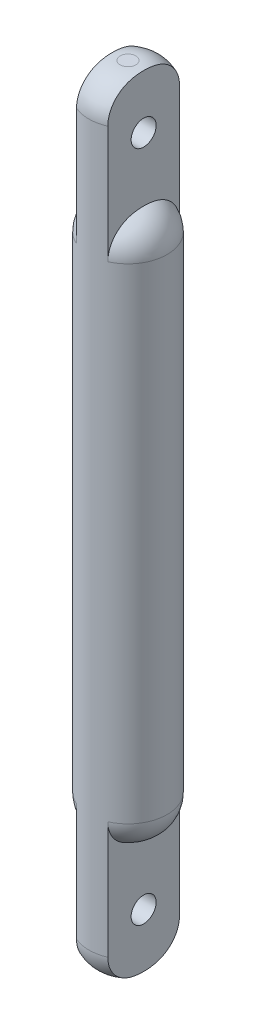
from build123d import *

# Parameters (mm, degrees)
SKETCH10_R              = 5
BOSS_EXTRUDE1_DEPTH     = 100
SKETCH11_W              = 10
SKETCH11_H              = 15
CUT_EXTRUDE1_DEPTH      = 100
SKETCH12_R              = 1.6
CUT_EXTRUDE2_DEPTH      = 101.369318021
MIRROR8_COPY_1_SKETCH_W = 10
MIRROR8_COPY_1_SKETCH_H = 15
MIRROR8_COPY_1_DEPTH    = 100
MIRROR8_COPY_2_SKETCH_W = 10
MIRROR8_COPY_2_SKETCH_H = 15
MIRROR8_COPY_2_DEPTH    = 100
FILLET1_R               = 4
FILLET2_R               = 4


with BuildPart() as part:
    # Sketch10 → Boss-Extrude1 (new body)
    with BuildSketch(Plane(origin=(0, 0, 0), x_dir=(1, 0, 0), z_dir=(0, 1, 0))):
        with Locations(Location((0, 0, 0), (0, 0, 270))):
            Circle(SKETCH10_R)
    extrude(amount=BOSS_EXTRUDE1_DEPTH)

    # Sketch11 → Cut-Extrude1 (cut)
    with BuildSketch(Plane(origin=(2, 0, 0), x_dir=(0, 0, -1), z_dir=(1, 0, 0))):
        with Locations((0, 7.5)):
            Rectangle(SKETCH11_W, SKETCH11_H)
    cut_extrude1 = extrude(amount=CUT_EXTRUDE1_DEPTH, mode=Mode.SUBTRACT)

    # Mirror1: Cut-Extrude1 across plane
    add(cut_extrude1.mirror(Plane(origin=(0, 0, 0), x_dir=(0, 0, 1), z_dir=(1, 0, 0))), mode=Mode.SUBTRACT)

    # Sketch12 → Cut-Extrude2 (cut, through all)
    with BuildSketch(Plane.ZY.offset(2)):
        with Locations((0, 7)):
            Circle(SKETCH12_R)
    cut_extrude2 = extrude(amount=-CUT_EXTRUDE2_DEPTH, mode=Mode.SUBTRACT)

    # Mirror7: Cut-Extrude1 across plane
    add(cut_extrude1.mirror(Plane(origin=(0, 50, 0), x_dir=(0, 0, 1), z_dir=(0, -1, 0))), mode=Mode.SUBTRACT)

    # Mirror8 copy 1 sketch → Mirror8 copy 1 (cut)
    with BuildSketch(Plane(origin=(-2, 100, 0), x_dir=(0, 0, -1), z_dir=(-1, 0, 0))):
        with Locations((0, 7.5)):
            Rectangle(MIRROR8_COPY_1_SKETCH_W, MIRROR8_COPY_1_SKETCH_H)
    extrude(amount=MIRROR8_COPY_1_DEPTH, mode=Mode.SUBTRACT)

    # Mirror8 copy 2 sketch → Mirror8 copy 2 (cut)
    with BuildSketch(Plane(origin=(2, 100, 0), x_dir=(0, 0, -1), z_dir=(1, 0, 0))):
        with Locations((0, -7.5)):
            Rectangle(MIRROR8_COPY_2_SKETCH_W, MIRROR8_COPY_2_SKETCH_H)
    extrude(amount=MIRROR8_COPY_2_DEPTH, mode=Mode.SUBTRACT)

    # Mirror9: Cut-Extrude2 across plane
    add(cut_extrude2.mirror(Plane(origin=(0, 50, 0), x_dir=(0, 0, 1), z_dir=(0, -1, 0))), mode=Mode.SUBTRACT)

    # Fillet1
    # the kernel refuses this fillet: 4 mm, written as the material it takes off along each edge
    with BuildSketch(Plane(origin=(0, 15, 0), x_dir=(0.9999950652018581, 0, 0.003141587485879613), z_dir=(0.003141587485879613, 0, -0.9999950652018581))) as fillet1_piece_1_section:
        with BuildLine():
            CenterArc((5 - FILLET1_R, -FILLET1_R), FILLET1_R, 0, 90)
            Line((5 - FILLET1_R, 0), (5, 0))
            Line((5, 0), (5, -FILLET1_R))
        make_face()
    fillet1_piece_1 = revolve(axis=Axis((0, 15, 0), (0, -1, 0)), revolution_arc=359.64, mode=Mode.PRIVATE)
    fillet1_piece_1 = split(fillet1_piece_1, bisect_by=Plane(origin=(2, 16.020930517, 2.132715254), z_dir=(1, 0, 0)), keep=Keep.TOP, mode=Mode.PRIVATE)
    add(fillet1_piece_1, mode=Mode.SUBTRACT)
    with BuildSketch(Plane(origin=(0, 15, 0), x_dir=(0.9999950652018581, 0, 0.003141587485879613), z_dir=(0.003141587485879613, 0, -0.9999950652018581))) as fillet1_piece_2_section:
        with BuildLine():
            CenterArc((5 - FILLET1_R, -FILLET1_R), FILLET1_R, 0, 90)
            Line((5 - FILLET1_R, 0), (5, 0))
            Line((5, 0), (5, -FILLET1_R))
        make_face()
    fillet1_piece_2 = revolve(axis=Axis((0, 15, 0), (0, -1, 0)), revolution_arc=359.64, mode=Mode.PRIVATE)
    fillet1_piece_2 = split(fillet1_piece_2, bisect_by=Plane(origin=(-2, 16.531416738, 0), z_dir=(-1, 0, 0)), keep=Keep.TOP, mode=Mode.PRIVATE)
    add(fillet1_piece_2, mode=Mode.SUBTRACT)
    with BuildSketch(Plane(origin=(0, 15, 0), x_dir=(-0.9999950652018581, 0, -0.0031415874858794907), z_dir=(-0.0031415874858794907, 0, 0.9999950652018581))) as fillet1_piece_3_section:
        with BuildLine():
            CenterArc((5 - FILLET1_R, -FILLET1_R), FILLET1_R, 0, 90)
            Line((5 - FILLET1_R, 0), (5, 0))
            Line((5, 0), (5, -FILLET1_R))
        make_face()
    fillet1_piece_3 = revolve(axis=Axis((0, 15, 0), (0, -1, 0)), revolution_arc=359.64, mode=Mode.PRIVATE)
    fillet1_piece_3 = split(fillet1_piece_3, bisect_by=Plane(origin=(-2, 16.020930615, -2.132715254), z_dir=(-1, 0, 0)), keep=Keep.TOP, mode=Mode.PRIVATE)
    add(fillet1_piece_3, mode=Mode.SUBTRACT)
    with BuildSketch(Plane(origin=(0, 15, 0), x_dir=(-0.9999950652018581, 0, -0.0031415874858794907), z_dir=(-0.0031415874858794907, 0, 0.9999950652018581))) as fillet1_piece_4_section:
        with BuildLine():
            CenterArc((5 - FILLET1_R, -FILLET1_R), FILLET1_R, 0, 90)
            Line((5 - FILLET1_R, 0), (5, 0))
            Line((5, 0), (5, -FILLET1_R))
        make_face()
    fillet1_piece_4 = revolve(axis=Axis((0, 15, 0), (0, -1, 0)), revolution_arc=359.64, mode=Mode.PRIVATE)
    fillet1_piece_4 = split(fillet1_piece_4, bisect_by=Plane(origin=(2, 16.531416738, 0), z_dir=(1, 0, 0)), keep=Keep.TOP, mode=Mode.PRIVATE)
    add(fillet1_piece_4, mode=Mode.SUBTRACT)
    with BuildSketch(Plane(origin=(0, 85, 0), x_dir=(-0.9999950652018581, 0, -0.0031415874858794907), z_dir=(-0.0031415874858794907, 0, 0.9999950652018581))) as fillet1_piece_5_section:
        with BuildLine():
            CenterArc((5 - FILLET1_R, FILLET1_R), FILLET1_R, 270, 90)
            Line((5 - FILLET1_R, 0), (5, 0))
            Line((5, 0), (5, FILLET1_R))
        make_face()
    fillet1_piece_5 = revolve(axis=Axis((0, 85, 0), (0, -1, 0)), revolution_arc=359.64, mode=Mode.PRIVATE)
    fillet1_piece_5 = split(fillet1_piece_5, bisect_by=Plane(origin=(-2, 83.979069385, -2.132715254), z_dir=(-1, 0, 0)), keep=Keep.TOP, mode=Mode.PRIVATE)
    add(fillet1_piece_5, mode=Mode.SUBTRACT)
    with BuildSketch(Plane(origin=(0, 85, 0), x_dir=(-0.9999950652018581, 0, -0.0031415874858794907), z_dir=(-0.0031415874858794907, 0, 0.9999950652018581))) as fillet1_piece_6_section:
        with BuildLine():
            CenterArc((5 - FILLET1_R, FILLET1_R), FILLET1_R, 270, 90)
            Line((5 - FILLET1_R, 0), (5, 0))
            Line((5, 0), (5, FILLET1_R))
        make_face()
    fillet1_piece_6 = revolve(axis=Axis((0, 85, 0), (0, -1, 0)), revolution_arc=359.64, mode=Mode.PRIVATE)
    fillet1_piece_6 = split(fillet1_piece_6, bisect_by=Plane(origin=(2, 83.468583262, 0), z_dir=(1, 0, 0)), keep=Keep.TOP, mode=Mode.PRIVATE)
    add(fillet1_piece_6, mode=Mode.SUBTRACT)
    with BuildSketch(Plane(origin=(0, 85, 0), x_dir=(0.9999950652018581, 0, 0.003141587485879613), z_dir=(0.003141587485879613, 0, -0.9999950652018581))) as fillet1_piece_7_section:
        with BuildLine():
            CenterArc((5 - FILLET1_R, FILLET1_R), FILLET1_R, 270, 90)
            Line((5 - FILLET1_R, 0), (5, 0))
            Line((5, 0), (5, FILLET1_R))
        make_face()
    fillet1_piece_7 = revolve(axis=Axis((0, 85, 0), (0, -1, 0)), revolution_arc=359.64, mode=Mode.PRIVATE)
    fillet1_piece_7 = split(fillet1_piece_7, bisect_by=Plane(origin=(2, 83.979069483, 2.132715254), z_dir=(1, 0, 0)), keep=Keep.TOP, mode=Mode.PRIVATE)
    add(fillet1_piece_7, mode=Mode.SUBTRACT)
    with BuildSketch(Plane(origin=(0, 85, 0), x_dir=(0.9999950652018581, 0, 0.003141587485879613), z_dir=(0.003141587485879613, 0, -0.9999950652018581))) as fillet1_piece_8_section:
        with BuildLine():
            CenterArc((5 - FILLET1_R, FILLET1_R), FILLET1_R, 270, 90)
            Line((5 - FILLET1_R, 0), (5, 0))
            Line((5, 0), (5, FILLET1_R))
        make_face()
    fillet1_piece_8 = revolve(axis=Axis((0, 85, 0), (0, -1, 0)), revolution_arc=359.64, mode=Mode.PRIVATE)
    fillet1_piece_8 = split(fillet1_piece_8, bisect_by=Plane(origin=(-2, 83.468583262, 0), z_dir=(-1, 0, 0)), keep=Keep.TOP, mode=Mode.PRIVATE)
    add(fillet1_piece_8, mode=Mode.SUBTRACT)

    # Fillet2
    # the kernel refuses this fillet: 4 mm, written as the material it takes off along each edge
    with BuildSketch(Plane(origin=(0, 0, 0), x_dir=(-0.6668850456417628, 0, -0.7451606108077533), z_dir=(0.7451606108077533, 0, -0.6668850456417628))) as fillet2_piece_1:
        with BuildLine():
            CenterArc((5 - FILLET2_R, FILLET2_R), FILLET2_R, 270, 90)
            Line((5 - FILLET2_R, 0), (5, 0))
            Line((5, 0), (5, FILLET2_R))
        make_face()
    revolve(axis=Axis((0, 0, 0), (0, 1, 0)), revolution_arc=138.172896035, mode=Mode.SUBTRACT)
    with BuildSketch(Plane(origin=(0, 0, 0), x_dir=(0.6667617921571638, 0, 0.7452708987471381), z_dir=(-0.7452708987471381, 0, 0.6667617921571638))) as fillet2_piece_2:
        with BuildLine():
            CenterArc((5 - FILLET2_R, FILLET2_R), FILLET2_R, 270, 90)
            Line((5 - FILLET2_R, 0), (5, 0))
            Line((5, 0), (5, FILLET2_R))
        make_face()
    revolve(axis=Axis((0, 0, 0), (0, 1, 0)), revolution_arc=276.364744713, mode=Mode.SUBTRACT)
    with BuildSketch(Plane(origin=(0, 100, 0), x_dir=(-0.6668850456417623, 0, -0.7451606108077536), z_dir=(0.7451606108077536, 0, -0.6668850456417623))) as fillet2_piece_3:
        with BuildLine():
            CenterArc((5 - FILLET2_R, -FILLET2_R), FILLET2_R, 0, 90)
            Line((5 - FILLET2_R, 0), (5, 0))
            Line((5, 0), (5, -FILLET2_R))
        make_face()
    revolve(axis=Axis((0, 100, 0), (0, 1, 0)), revolution_arc=138.172896035, mode=Mode.SUBTRACT)
    with BuildSketch(Plane(origin=(0, 100, 0), x_dir=(0.6667617921571635, 0, 0.7452708987471385), z_dir=(-0.7452708987471385, 0, 0.6667617921571635))) as fillet2_piece_4:
        with BuildLine():
            CenterArc((5 - FILLET2_R, -FILLET2_R), FILLET2_R, 0, 90)
            Line((5 - FILLET2_R, 0), (5, 0))
            Line((5, 0), (5, -FILLET2_R))
        make_face()
    revolve(axis=Axis((0, 100, 0), (0, 1, 0)), revolution_arc=276.364744713, mode=Mode.SUBTRACT)
    with BuildSketch(Plane(origin=(0, 100, 0), x_dir=(0, 0, 1), z_dir=(-1, 0, 0))) as fillet2_piece_5:
        with BuildLine():
            CenterArc((5 - FILLET2_R, -FILLET2_R), FILLET2_R, 0, 90)
            Line((5 - FILLET2_R, 0), (5, 0))
            Line((5, 0), (5, -FILLET2_R))
        make_face()
    revolve(axis=Axis((0, 100, 0), (0, 1, 0)), revolution_arc=138.172896035, mode=Mode.SUBTRACT)
    with BuildSketch(Plane(origin=(0, 0, 0), x_dir=(0, 0, 1), z_dir=(-1, 0, 0))) as fillet2_piece_6:
        with BuildLine():
            CenterArc((5 - FILLET2_R, FILLET2_R), FILLET2_R, 270, 90)
            Line((5 - FILLET2_R, 0), (5, 0))
            Line((5, 0), (5, FILLET2_R))
        make_face()
    revolve(axis=Axis((0, 0, 0), (0, 1, 0)), revolution_arc=138.172896035, mode=Mode.SUBTRACT)


solid = part.part
